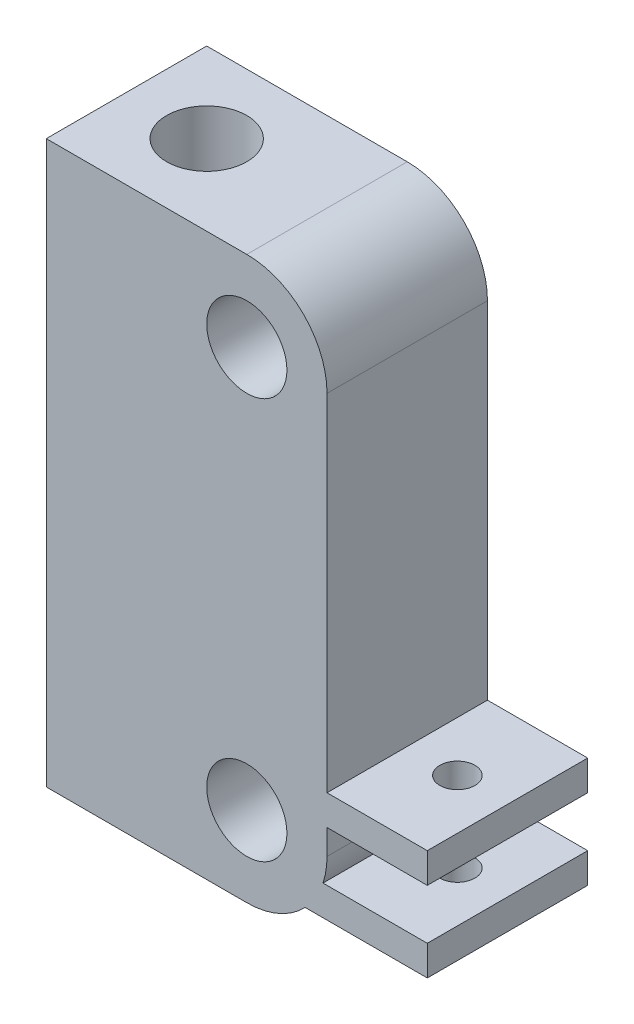
from build123d import *

# Parameters (mm, degrees)
SKETCH1_R           = 4
BOSS_EXTRUDE1_DEPTH = 16
SKETCH2_R           = 4
CUT_EXTRUDE1_DEPTH  = 63.237043653
SKETCH3_R           = 1.75
CUT_EXTRUDE2_DEPTH  = 51.435102881


with BuildPart() as part:
    # Sketch1 → Boss-Extrude1 (new body)
    with BuildSketch(Plane.XY):
        with BuildLine():
            Line((11.941959863, -20.868835105), (21.941959863, -20.868835105))
            Line((21.941959863, -20.868835105), (21.941959863, -23.868835105))
            Line((21.941959863, -23.868835105), (11.941959863, -23.868835105))
            Line((11.941959863, -23.868835105), (11.941959863, -26.368835105))
            ThreePointArc((11.941959863, -26.368835105), (11.841160348, -27.63478601), (11.541301939, -28.868835105))
            Line((11.541301939, -28.868835105), (21.941959863, -28.868835105))
            Line((21.941959863, -28.868835105), (21.941959863, -31.868835105))
            Line((21.941959863, -31.868835105), (9.751434882, -31.868835105))
            ThreePointArc((9.751434882, -31.868835105), (7.104237523, -33.717304334), (3.941959863, -34.368835105))
            Line((3.941959863, -34.368835105), (-16.058040137, -34.368835105))
            Line((-16.058040137, -34.368835105), (-16.058040137, 21.631164895))
            Line((-16.058040137, 21.631164895), (3.941959863, 21.631164895))
            ThreePointArc((3.941959863, 21.631164895), (9.598814112, 19.288019144), (11.941959863, 13.631164895))
            Line((11.941959863, 13.631164895), (11.941959863, -20.868835105))
        make_face()
        with Locations((3.941959863, 13.631164895)):
            Circle(SKETCH1_R, mode=Mode.SUBTRACT)
        with Locations((3.941959863, -26.368835105)):
            Circle(SKETCH1_R, mode=Mode.SUBTRACT)
    extrude(amount=-BOSS_EXTRUDE1_DEPTH)

    # Sketch2 → Cut-Extrude1 (cut, through all)
    with BuildSketch(Plane(origin=(0, 21.631164895, 0), x_dir=(1, 0, 0), z_dir=(0, 1, 0))):
        with Locations((-8.058040137, 8)):
            Circle(SKETCH2_R)
    extrude(amount=-CUT_EXTRUDE1_DEPTH, mode=Mode.SUBTRACT)

    # Sketch3 → Cut-Extrude2 (cut, through all)
    with BuildSketch(Plane(origin=(0, -20.868835105, 0), x_dir=(1, 0, 0), z_dir=(0, 1, 0))):
        with Locations((16.941959863, 8)):
            Circle(SKETCH3_R)
    extrude(amount=-CUT_EXTRUDE2_DEPTH, mode=Mode.SUBTRACT)


solid = part.part
